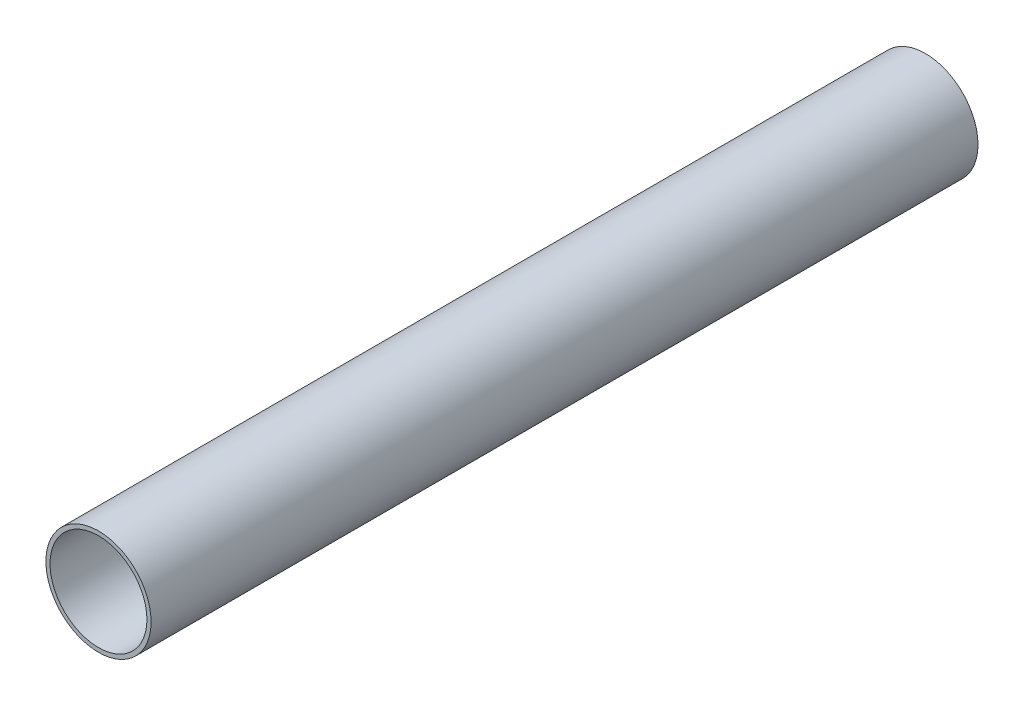
from build123d import *

# Parameters (mm, degrees)
SKETCH1_R           = 15.9
SKETCH1_R_2         = 14.65
BOSS_EXTRUDE1_DEPTH = 250


with BuildPart() as part:
    # Sketch1 → Boss-Extrude1 (new body)
    with BuildSketch(Plane.XY):
        Circle(SKETCH1_R)
        Circle(SKETCH1_R_2, mode=Mode.SUBTRACT)
    extrude(amount=-BOSS_EXTRUDE1_DEPTH)


solid = part.part
